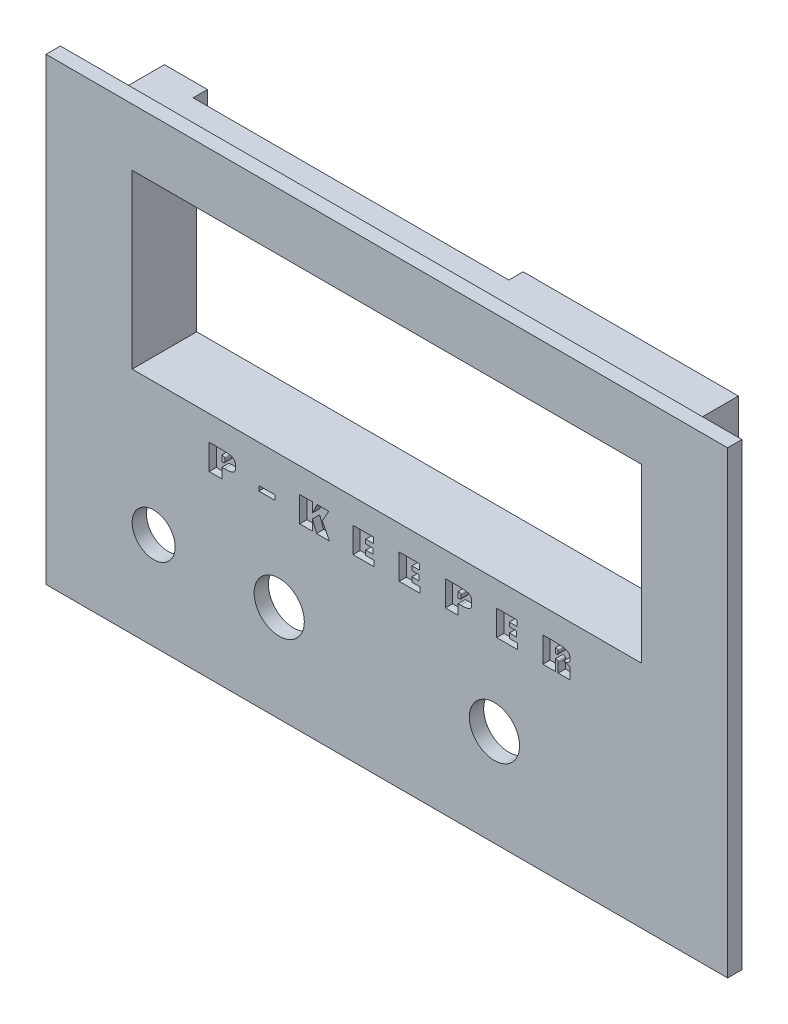
from build123d import *

# Parameters (mm, degrees)
SKETCH3_W              = 95
SKETCH3_H              = 64
SKETCH3_R              = 3
SKETCH3_R_2            = 3.5
SKETCH3_W_2            = 71
SKETCH3_H_2            = 24
BOSS_EXTRUDE2_DEPTH    = 2
SKETCH5_W              = 80
SKETCH5_H              = 36
SKETCH5_W_2            = 71
SKETCH5_H_2            = 24
BOSS_EXTRUDE3_DEPTH    = 7
SKETCH6_W              = 12.660635262
SKETCH6_H              = 19
CUT_EXTRUDE1_DEPTH     = 4
SKETCH7_W              = 44
SKETCH7_H              = 6.684422235
CUT_EXTRUDE2_DEPTH     = 2
CUT_EXTRUDE3_START     = -1
CUT_EXTRUDE3_OUTLINE_W = 2.223529412
CUT_EXTRUDE3_OUTLINE_H = 0.658823529
CUT_EXTRUDE3_DEPTH     = 1


# Read off the part's stored shape, not the designer's step: Cut-Extrude3
with BuildPart() as part:
    # Sketch3 → Boss-Extrude2 (new body)
    with BuildSketch(Plane.XY):
        Rectangle(SKETCH3_W, SKETCH3_H)
        with Locations((-32.5, -18.5)):
            Circle(SKETCH3_R, mode=Mode.SUBTRACT)
        with Locations((-15, -18.5)):
            Circle(SKETCH3_R_2, mode=Mode.SUBTRACT)
        with Locations((15, -18.5)):
            Circle(SKETCH3_R_2, mode=Mode.SUBTRACT)
        with Locations((0, 12)):
            Rectangle(SKETCH3_W_2, SKETCH3_H_2, mode=Mode.SUBTRACT)
    extrude(amount=BOSS_EXTRUDE2_DEPTH)

    # Sketch5 → Boss-Extrude3 (add)
    with BuildSketch(Plane(origin=(0, 0, 0), x_dir=(-1, 0, 0), z_dir=(0, 0, -1))):
        with Locations((0, 12)):
            Rectangle(SKETCH5_W, SKETCH5_H)
        with Locations((0, 12)):
            Rectangle(SKETCH5_W_2, SKETCH5_H_2, mode=Mode.SUBTRACT)
    extrude(amount=BOSS_EXTRUDE3_DEPTH)

    # Sketch6 → Cut-Extrude1 (cut)
    with BuildSketch(Plane(origin=(0, 0, -7), x_dir=(-1, 0, 0), z_dir=(0, 0, -1))):
        with Locations((-40, 12)):
            Rectangle(SKETCH6_W, SKETCH6_H)
    extrude(amount=-CUT_EXTRUDE1_DEPTH, mode=Mode.SUBTRACT)

    # Sketch7 → Cut-Extrude2 (cut)
    with BuildSketch(Plane(origin=(0, 0, -7), x_dir=(-1, 0, 0), z_dir=(0, 0, -1))):
        with Locations((12, 26.923367336)):
            Rectangle(SKETCH7_W, SKETCH7_H)
    extrude(amount=-CUT_EXTRUDE2_DEPTH, mode=Mode.SUBTRACT)

    # Cut-Extrude3 outline → Cut-Extrude3 (cut)
    # profile 1 of 8: a face of its own
    with BuildSketch(Plane.XY.offset(2).offset(CUT_EXTRUDE3_START)):
        with BuildLine():
            add(Edge.make_bspline(
                [(22.953713235, -3.458823529), (23.001323523, -3.458781847), (23.094614455, -3.458700172), (23.231657591, -3.459285481), (23.363118019, -3.460822847), (23.488799017, -3.461789945), (23.608890297, -3.464017411), (23.722992092, -3.465693482), (23.831513449, -3.468259594), (23.934014791, -3.471652338), (24.030965451, -3.474685607), (24.122120558, -3.478471803), (24.207668393, -3.483209091), (24.287482467, -3.487392283), (24.361443449, -3.492794688), (24.429891588, -3.497729447), (24.492537741, -3.503414495), (24.567698307, -3.511987922), (24.655752817, -3.524512092), (24.756746205, -3.54504177), (24.852840764, -3.570685771), (24.943971915, -3.601659727), (25.030402809, -3.637730954), (25.112272475, -3.678743752), (25.189119131, -3.725450505), (25.26126891, -3.776361966), (25.327171017, -3.833676586), (25.384080494, -3.899064398), (25.431917973, -3.971945974), (25.47166325, -4.051727358), (25.501508543, -4.139252377), (25.523444031, -4.233624181), (25.536276704, -4.335402308), (25.537955993, -4.405630985), (25.538823529, -4.441911765)],
                knots=[0, 0, 0, 0, 0.045876379, 0.089893389, 0.132052087, 0.172557665, 0.21099963, 0.247788617, 0.282515715, 0.315595913, 0.346610682, 0.375981215, 0.403503753, 0.429169195, 0.452991419, 0.474958653, 0.49529561, 0.513597879, 0.547849513, 0.580960678, 0.612841812, 0.643621617, 0.673633624, 0.703022326, 0.73176456, 0.760207337, 0.78802619, 0.815708854, 0.843449307, 0.87182143, 0.90136159, 0.93233985, 0.965046145, 1, 1, 1, 1], degree=3))
            Line((22.953713235, -3.458823529), (21.750588235, -3.458823529))
            Line((21.750588235, -3.458823529), (21.750588235, -7))
            Line((21.750588235, -7), (23.521176471, -7))
            Line((23.521176471, -7), (23.521176471, -5.435294118))
            add(Edge.make_bspline(
                [(23.891764706, -5.805882353), (23.891418904, -5.7852921), (23.890763055, -5.746240477), (23.888558617, -5.690832643), (23.883722855, -5.641763848), (23.875683106, -5.59935909), (23.867406832, -5.562840081), (23.855572392, -5.532921288), (23.84271207, -5.508667761), (23.826039916, -5.490354071), (23.80528392, -5.47734176), (23.78055991, -5.465577359), (23.750172932, -5.456293274), (23.714596535, -5.44886559), (23.673831756, -5.442283925), (23.627625724, -5.438058666), (23.576109143, -5.435466497), (23.540052589, -5.435353351), (23.521176471, -5.435294118)],
                knots=[0, 0, 0, 0, 0.096152594, 0.182363706, 0.258888464, 0.326062556, 0.383865244, 0.433329384, 0.475931859, 0.511364025, 0.547469015, 0.589574306, 0.638977591, 0.695348711, 0.759224957, 0.831663701, 0.911873554, 1, 1, 1, 1], degree=3))
            Line((23.891764706, -5.805882353), (23.891764706, -7))
            Line((23.891764706, -7), (25.538823529, -7))
            Line((25.538823529, -7), (25.538823529, -6.044577206))
            add(Edge.make_bspline(
                [(24.638731618, -5.167647059), (24.67434968, -5.16882252), (24.743099085, -5.171091376), (24.842037378, -5.179620721), (24.932862764, -5.191012096), (25.015684445, -5.205484264), (25.090244066, -5.224113529), (25.15698308, -5.24558127), (25.215400393, -5.271321137), (25.279903817, -5.308936954), (25.346308539, -5.358225383), (25.413820217, -5.414184362), (25.462485394, -5.469583099), (25.492326438, -5.516522319), (25.506110796, -5.558991414), (25.514763397, -5.599084595), (25.522263837, -5.648951701), (25.528736461, -5.708823008), (25.53257264, -5.7788404), (25.536885565, -5.858592789), (25.538421357, -5.948279095), (25.538684704, -6.011336165), (25.538823529, -6.044577206)],
                knots=[0, 0, 0, 0, 0.071505855, 0.138019438, 0.199194886, 0.255165239, 0.306625287, 0.353306667, 0.395693756, 0.434449081, 0.502890994, 0.561475859, 0.609978645, 0.650500292, 0.671867914, 0.69922302, 0.732761963, 0.773017621, 0.820025207, 0.873454229, 0.933290381, 1, 1, 1, 1], degree=3))
            add(Edge.make_bspline(
                [(25.538823529, -4.441911765), (25.53827887, -4.474754883), (25.537229708, -4.538019739), (25.527249654, -4.628733732), (25.512580728, -4.711916593), (25.489658218, -4.786748674), (25.462033013, -4.854555622), (25.426000596, -4.913480181), (25.384868206, -4.965217519), (25.335940026, -5.008650048), (25.279041078, -5.044831372), (25.214515835, -5.077150115), (25.140443821, -5.104093628), (25.057300688, -5.125201811), (24.965428447, -5.143440263), (24.864648497, -5.156665081), (24.754670848, -5.164922808), (24.678421644, -5.166714453), (24.638731618, -5.167647059)],
                knots=[0, 0, 0, 0, 0.073090733, 0.140792803, 0.20297299, 0.260824797, 0.314742112, 0.365510526, 0.414054616, 0.461398081, 0.510397906, 0.563779816, 0.621787067, 0.685483118, 0.754588264, 0.830217451, 0.911623027, 1, 1, 1, 1], degree=3))
        make_face()
        with BuildLine():
            add(Edge.make_bspline(
                [(23.891764706, -4.347977941), (23.890766138, -4.32641973), (23.888912028, -4.2863911), (23.872737415, -4.231671253), (23.843076309, -4.188787605), (23.800060922, -4.159741825), (23.746705149, -4.140484794), (23.682202863, -4.12670918), (23.605656897, -4.118751827), (23.55057724, -4.118031539), (23.521176471, -4.117647059)],
                knots=[0, 0, 0, 0, 0.128318995, 0.238258811, 0.335422291, 0.432585772, 0.542235498, 0.671846328, 0.824836045, 1, 1, 1, 1], degree=3))
            Line((23.891764706, -4.347977941), (23.891764706, -4.541636029))
            add(Edge.make_bspline(
                [(23.521176471, -4.817647059), (23.550131738, -4.81707418), (23.604048412, -4.81600744), (23.679493008, -4.810363736), (23.743065117, -4.798430248), (23.78975933, -4.786587767), (23.821078118, -4.770947219), (23.840365696, -4.753286301), (23.856083596, -4.730387728), (23.870008277, -4.702833741), (23.879923302, -4.669726975), (23.886643611, -4.631503426), (23.891329255, -4.5882877), (23.89161444, -4.5577346), (23.891764706, -4.541636029)],
                knots=[0, 0, 0, 0, 0.157074725, 0.292483798, 0.409509027, 0.507760673, 0.55250241, 0.597799967, 0.64782275, 0.702434523, 0.764598259, 0.834398005, 0.912743536, 1, 1, 1, 1], degree=3))
            Line((23.521176471, -4.817647059), (23.521176471, -4.117647059))
        make_face(mode=Mode.SUBTRACT)
    # profile 2 of 8: a face of its own
    with BuildSketch(Plane.XY.offset(2).offset(CUT_EXTRUDE3_START)):
        with BuildLine():
            add(Edge.make_bspline(
                [(9.8671875, -3.458823529), (9.922306484, -3.458810423), (10.029338076, -3.458784972), (10.185249428, -3.462498794), (10.331540899, -3.466607219), (10.468388102, -3.473073293), (10.595596396, -3.481301978), (10.713377122, -3.491497662), (10.821519589, -3.503593382), (10.920872171, -3.517737931), (11.012593524, -3.534166242), (11.098631055, -3.551028641), (11.178702539, -3.571339915), (11.253892476, -3.592084847), (11.323014695, -3.616167712), (11.387344807, -3.640909341), (11.445596041, -3.668650788), (11.514721699, -3.706358914), (11.590202538, -3.757579196), (11.667650261, -3.82484334), (11.727289221, -3.899028892), (11.76324449, -3.966309126), (11.785071285, -4.023670684), (11.79804274, -4.071856403), (11.809672564, -4.124878749), (11.819381733, -4.182828935), (11.826141106, -4.246006533), (11.831255823, -4.314240355), (11.834473455, -4.387623295), (11.835014524, -4.438262635), (11.835294118, -4.464430147)],
                knots=[0, 0, 0, 0, 0.064770799, 0.125773755, 0.183262426, 0.236751037, 0.286759337, 0.333055773, 0.375665812, 0.414622156, 0.45096004, 0.48516303, 0.517620426, 0.548015255, 0.576786923, 0.603603566, 0.628969307, 0.652542698, 0.696091197, 0.735899111, 0.772661018, 0.807277486, 0.825064421, 0.844693234, 0.865851291, 0.888846373, 0.913699878, 0.940490455, 0.969248874, 1, 1, 1, 1], degree=3))
            Line((9.8671875, -3.458823529), (8.170588235, -3.458823529))
            Line((8.170588235, -3.458823529), (8.170588235, -7))
            Line((8.170588235, -7), (9.941176471, -7))
            Line((9.941176471, -7), (9.941176471, -5.6))
            Line((9.941176471, -5.6), (10.299540441, -5.6))
            add(Edge.make_bspline(
                [(11.835294118, -4.764889706), (11.834982557, -4.791709161), (11.834375913, -4.843929619), (11.828010218, -4.91961658), (11.816966537, -4.990069444), (11.802502042, -5.055386388), (11.783233429, -5.11523041), (11.759907418, -5.17001555), (11.732553561, -5.219749523), (11.699616743, -5.264247677), (11.661602364, -5.305068773), (11.616515793, -5.342309098), (11.565236356, -5.377728221), (11.506514822, -5.409738494), (11.441668723, -5.439969903), (11.369721014, -5.467401662), (11.291319377, -5.493401156), (11.205647309, -5.515442976), (11.113772952, -5.535305505), (11.015690553, -5.552664377), (10.911595372, -5.56724223), (10.801352397, -5.579726688), (10.684777592, -5.588132768), (10.561910434, -5.595647712), (10.432742142, -5.599228879), (10.344578663, -5.599739268), (10.299540441, -5.6)],
                knots=[0, 0, 0, 0, 0.040193707, 0.07826161, 0.113724024, 0.147022386, 0.178434846, 0.207812577, 0.236162833, 0.26329503, 0.290586718, 0.319562468, 0.350770306, 0.383866339, 0.419676717, 0.457942264, 0.49921415, 0.543423558, 0.590459662, 0.640086015, 0.692684293, 0.74799173, 0.806349252, 0.867849294, 0.93249095, 1, 1, 1, 1], degree=3))
            Line((11.835294118, -4.764889706), (11.835294118, -4.464430147))
        make_face()
        with BuildLine():
            add(Edge.make_bspline(
                [(10.352941176, -4.367922794), (10.351874549, -4.344045098), (10.349913278, -4.300139784), (10.334953135, -4.239895462), (10.305616729, -4.193696152), (10.271380395, -4.166750336), (10.238661712, -4.152905088), (10.209698195, -4.143061), (10.175908345, -4.135942575), (10.13785127, -4.128428197), (10.095039942, -4.123569956), (10.047570711, -4.120756629), (9.995899258, -4.117742535), (9.959839766, -4.117679621), (9.941176471, -4.117647059)],
                knots=[0, 0, 0, 0, 0.127538611, 0.234512685, 0.327269908, 0.414556293, 0.462231776, 0.516555193, 0.577672725, 0.646406101, 0.723682103, 0.807480363, 0.900357697, 1, 1, 1, 1], degree=3))
            Line((10.352941176, -4.367922794), (10.352941176, -4.660018382))
            add(Edge.make_bspline(
                [(9.982352941, -4.941176471), (9.999943304, -4.941129962), (10.033644081, -4.941040859), (10.081701912, -4.938272336), (10.125315669, -4.934642193), (10.164469537, -4.929037733), (10.19923613, -4.921250044), (10.229463461, -4.912541635), (10.255224183, -4.902154693), (10.284293162, -4.885972528), (10.314383143, -4.854549954), (10.337613263, -4.802368984), (10.351161123, -4.7359799), (10.352311215, -4.686901205), (10.352941176, -4.660018382)],
                knots=[0, 0, 0, 0, 0.095480873, 0.182928551, 0.261249787, 0.333041826, 0.397448512, 0.454547416, 0.503628478, 0.547964246, 0.634414094, 0.733879524, 0.854232684, 1, 1, 1, 1], degree=3))
            Line((9.982352941, -4.941176471), (9.941176471, -4.941819853))
            Line((9.941176471, -4.941819853), (9.941176471, -4.117647059))
        make_face(mode=Mode.SUBTRACT)
    # profile 3 of 8: a face of its own
    with BuildSketch(Plane.XY.offset(2).offset(CUT_EXTRUDE3_START)):
        with BuildLine():
            add(Edge.make_bspline(
                [(-23.073988971, -3.458823529), (-23.018869986, -3.458810423), (-22.911838395, -3.458784972), (-22.755927043, -3.462498794), (-22.609635572, -3.466607219), (-22.472788368, -3.473073293), (-22.345580075, -3.481301978), (-22.227799348, -3.491497662), (-22.119656881, -3.503593382), (-22.0203043, -3.517737931), (-21.928582946, -3.534166242), (-21.842545416, -3.551028641), (-21.762473932, -3.571339915), (-21.687283995, -3.592084847), (-21.618161776, -3.616167712), (-21.553831664, -3.640909341), (-21.495580429, -3.668650788), (-21.426454771, -3.706358914), (-21.350973933, -3.757579196), (-21.27352621, -3.82484334), (-21.213887249, -3.899028892), (-21.177931981, -3.966309126), (-21.156105186, -4.023670684), (-21.143133731, -4.071856403), (-21.131503907, -4.124878749), (-21.121794737, -4.182828935), (-21.115035365, -4.246006533), (-21.109920648, -4.314240355), (-21.106703016, -4.387623295), (-21.106161947, -4.438262635), (-21.105882353, -4.464430147)],
                knots=[0, 0, 0, 0, 0.064770799, 0.125773755, 0.183262426, 0.236751037, 0.286759337, 0.333055773, 0.375665812, 0.414622156, 0.45096004, 0.48516303, 0.517620426, 0.548015255, 0.576786923, 0.603603566, 0.628969307, 0.652542698, 0.696091197, 0.735899111, 0.772661018, 0.807277486, 0.825064421, 0.844693234, 0.865851291, 0.888846373, 0.913699878, 0.940490455, 0.969248874, 1, 1, 1, 1], degree=3))
            Line((-23.073988971, -3.458823529), (-24.770588235, -3.458823529))
            Line((-24.770588235, -3.458823529), (-24.770588235, -7))
            Line((-24.770588235, -7), (-23, -7))
            Line((-23, -7), (-23, -5.6))
            Line((-23, -5.6), (-22.641636029, -5.6))
            add(Edge.make_bspline(
                [(-21.105882353, -4.764889706), (-21.106193914, -4.791709161), (-21.106800558, -4.843929619), (-21.113166253, -4.91961658), (-21.124209933, -4.990069444), (-21.138674428, -5.055386388), (-21.157943042, -5.11523041), (-21.181269052, -5.17001555), (-21.208622909, -5.219749523), (-21.241559727, -5.264247677), (-21.279574106, -5.305068773), (-21.324660678, -5.342309098), (-21.375940114, -5.377728221), (-21.434661649, -5.409738494), (-21.499507747, -5.439969903), (-21.571455456, -5.467401662), (-21.649857094, -5.493401156), (-21.735529162, -5.515442976), (-21.827403519, -5.535305505), (-21.925485918, -5.552664377), (-22.029581099, -5.56724223), (-22.139824074, -5.579726688), (-22.256398879, -5.588132768), (-22.379266036, -5.595647712), (-22.508434329, -5.599228879), (-22.596597808, -5.599739268), (-22.641636029, -5.6)],
                knots=[0, 0, 0, 0, 0.040193707, 0.07826161, 0.113724024, 0.147022386, 0.178434846, 0.207812577, 0.236162833, 0.26329503, 0.290586718, 0.319562468, 0.350770306, 0.383866339, 0.419676717, 0.457942264, 0.49921415, 0.543423558, 0.590459662, 0.640086015, 0.692684293, 0.74799173, 0.806349252, 0.867849294, 0.93249095, 1, 1, 1, 1], degree=3))
            Line((-21.105882353, -4.764889706), (-21.105882353, -4.464430147))
        make_face()
        with BuildLine():
            add(Edge.make_bspline(
                [(-22.588235294, -4.367922794), (-22.589301922, -4.344045098), (-22.591263193, -4.300139784), (-22.606223335, -4.239895462), (-22.635559742, -4.193696152), (-22.669796076, -4.166750336), (-22.702514759, -4.152905088), (-22.731478276, -4.143061), (-22.765268126, -4.135942575), (-22.803325201, -4.128428197), (-22.846136529, -4.123569956), (-22.89360576, -4.120756629), (-22.945277212, -4.117742535), (-22.981336705, -4.117679621), (-23, -4.117647059)],
                knots=[0, 0, 0, 0, 0.127538611, 0.234512685, 0.327269908, 0.414556293, 0.462231776, 0.516555193, 0.577672725, 0.646406101, 0.723682103, 0.807480363, 0.900357697, 1, 1, 1, 1], degree=3))
            Line((-22.588235294, -4.367922794), (-22.588235294, -4.660018382))
            add(Edge.make_bspline(
                [(-22.958823529, -4.941176471), (-22.941233167, -4.941129962), (-22.90753239, -4.941040859), (-22.859474559, -4.938272336), (-22.815860801, -4.934642193), (-22.776706933, -4.929037733), (-22.74194034, -4.921250044), (-22.71171301, -4.912541635), (-22.685952288, -4.902154693), (-22.656883309, -4.885972528), (-22.626793328, -4.854549954), (-22.603563208, -4.802368984), (-22.590015347, -4.7359799), (-22.588865256, -4.686901205), (-22.588235294, -4.660018382)],
                knots=[0, 0, 0, 0, 0.095480873, 0.182928551, 0.261249787, 0.333041826, 0.397448512, 0.454547416, 0.503628478, 0.547964246, 0.634414094, 0.733879524, 0.854232684, 1, 1, 1, 1], degree=3))
            Line((-22.958823529, -4.941176471), (-23, -4.941819853))
            Line((-23, -4.941819853), (-23, -4.117647059))
        make_face(mode=Mode.SUBTRACT)
    # profile 4 of 8: a face of its own
    with BuildSketch(Plane.XY.offset(2).offset(CUT_EXTRUDE3_START)):
        Polygon((18.151764706, -3.458823529), (15.310588235, -3.458823529), (15.310588235, -7), (18.234117647, -7), (18.234117647, -6.217647059), (17.081176471, -6.217647059), (17.081176471, -5.558823529), (18.069411765, -5.558823529), (18.069411765, -4.817647059), (17.081176471, -4.817647059), (17.081176471, -4.241176471), (18.151764706, -4.241176471), align=None)
    # profile 5 of 8: a face of its own
    with BuildSketch(Plane.XY.offset(2).offset(CUT_EXTRUDE3_START)):
        Polygon((4.571764706, -3.458823529), (1.730588235, -3.458823529), (1.730588235, -7), (4.654117647, -7), (4.654117647, -6.217647059), (3.501176471, -6.217647059), (3.501176471, -5.558823529), (4.489411765, -5.558823529), (4.489411765, -4.817647059), (3.501176471, -4.817647059), (3.501176471, -4.241176471), (4.571764706, -4.241176471), align=None)
    # profile 6 of 8: a face of its own
    with BuildSketch(Plane.XY.offset(2).offset(CUT_EXTRUDE3_START)):
        Polygon((-1.868235294, -3.458823529), (-4.709411765, -3.458823529), (-4.709411765, -7), (-1.785882353, -7), (-1.785882353, -6.217647059), (-2.938823529, -6.217647059), (-2.938823529, -5.558823529), (-1.950588235, -5.558823529), (-1.950588235, -4.817647059), (-2.938823529, -4.817647059), (-2.938823529, -4.241176471), (-1.868235294, -4.241176471), align=None)
    # profile 7 of 8: a face of its own
    with BuildSketch(Plane.XY.offset(2).offset(CUT_EXTRUDE3_START)):
        Polygon((-8.081764706, -3.458823529), (-9.711452206, -3.458823529), (-10.367058824, -4.802849265), (-10.367058824, -3.458823529), (-12.137647059, -3.458823529), (-12.137647059, -7), (-10.367058824, -7), (-10.367058824, -5.517647059), (-9.797022059, -7), (-7.999411765, -7), (-9.008235294, -5.062132353), align=None)
    # profile 8 of 8: a face of its own
    with BuildSketch(Plane.XY.offset(2).offset(CUT_EXTRUDE3_START)):
        with Locations((-16.724705882, -5.558823529)):
            Rectangle(CUT_EXTRUDE3_OUTLINE_W, CUT_EXTRUDE3_OUTLINE_H)
    extrude(amount=CUT_EXTRUDE3_DEPTH, mode=Mode.SUBTRACT)


solid = part.part
